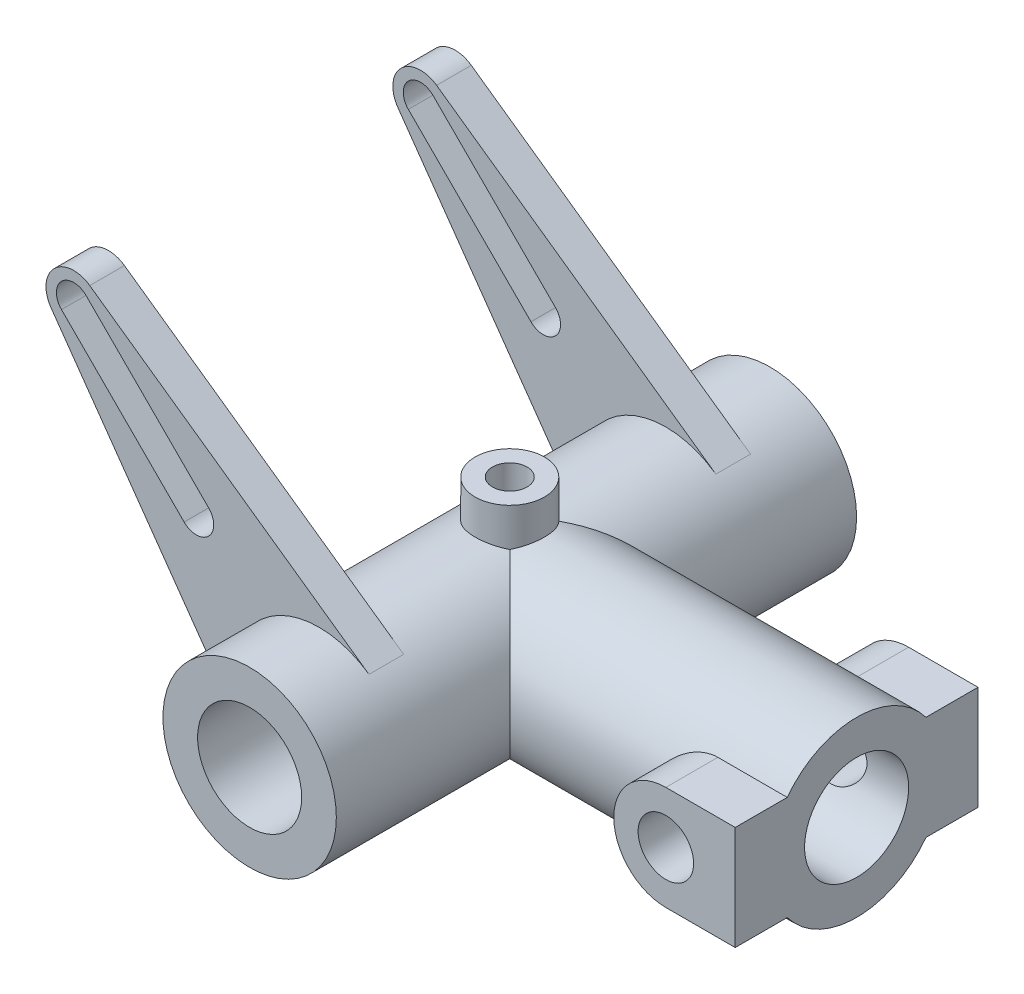
from build123d import *

# Parameters (mm, degrees)
CROQUIS1_R                   = 25
CROQUIS1_R_2                 = 15
SALIENTE_EXTRUIR1_DEPTH      = 75
SALIENTE_EXTRUIR3_REACH      = 184.916
SALIENTE_EXTRUIR3_END_RADIUS = 25
SALIENTE_EXTRUIR3_START      = 100
CROQUIS2_R                   = 25
CROQUIS2_R_2                 = 15
CORTAR_EXTRUIR1_REACH        = 129.475
CROQUIS2_2_R                 = 15
SALIENTE_EXTRUIR4_REACH      = 164.475
SALIENTE_EXTRUIR4_END_RADIUS = 25
SALIENTE_EXTRUIR4_START      = 35
CROQUIS3_W                   = 35
CROQUIS3_H                   = 30
REDONDEO1_R                  = 15
CROQUIS4_R                   = 8
CORTAR_EXTRUIR2_DEPTH        = 151.7481344
SALIENTE_EXTRUIR5_START      = 55
SALIENTE_EXTRUIR5_DEPTH      = 10
SALIENTE_EXTRUIR6_START      = 22.912881
CROQUIS6_R                   = 10
CROQUIS6_R_2                 = 5
SALIENTE_EXTRUIR6_DEPTH      = 12.087119
CORTAR_EXTRUIR3_REACH        = 149.717
CROQUIS6_2_R                 = 5
REDONDEO1_OF_SIMETR_A1_R     = 15


with BuildPart() as part:
    # Croquis1 → Saliente-Extruir1 (new, symmetric)
    with BuildSketch(Plane.XY):
        Circle(CROQUIS1_R)
        Circle(CROQUIS1_R_2, mode=Mode.SUBTRACT)
    extrude(amount=SALIENTE_EXTRUIR1_DEPTH, both=True)

    # Saliente-Extruir3: up to this cylinder (the profile starts outside it)
    saliente_extruir3_end = Plane(origin=(0, 0, 24.292893), z_dir=(0, 0, -1)) * Cylinder(SALIENTE_EXTRUIR3_END_RADIUS, 420.832, mode=Mode.PRIVATE)
    # Croquis2 → Saliente-Extruir3 (add, up to the surface)
    with BuildSketch(Plane(origin=(0, 0, 0), x_dir=(0, 0, -1), z_dir=(1, 0, 0)).offset(SALIENTE_EXTRUIR3_START), mode=Mode.PRIVATE) as saliente_extruir3_sk1:
        Circle(CROQUIS2_R)
        Circle(CROQUIS2_R_2, mode=Mode.SUBTRACT)
    saliente_extruir3_tool1 = extrude(saliente_extruir3_sk1.sketch, amount=-SALIENTE_EXTRUIR3_REACH, mode=Mode.PRIVATE) - saliente_extruir3_end
    add(saliente_extruir3_tool1.solids().sort_by_distance((100, 0, 24.292893))[0])

    # Croquis2<2> → Cortar-Extruir1 (cut, up to next)
    with BuildSketch(Plane(origin=(0, 0, 0), x_dir=(0, 0, -1), z_dir=(1, 0, 0)), mode=Mode.PRIVATE) as cortar_extruir1_sk1:
        Circle(CROQUIS2_2_R)
    cortar_extruir1_tool1 = extrude(cortar_extruir1_sk1.sketch, amount=CORTAR_EXTRUIR1_REACH, mode=Mode.PRIVATE) & part.part
    add(cortar_extruir1_tool1.solids().sort_by_distance((0, 0, 0))[0], mode=Mode.SUBTRACT)

    # Saliente-Extruir4: up to this cylinder (the profile starts outside it)
    saliente_extruir4_end = Plane(origin=(82.5, 0, 0), z_dir=(1, 0, 0)) * Cylinder(SALIENTE_EXTRUIR4_END_RADIUS, 379.95, mode=Mode.PRIVATE)
    # Croquis3 → Saliente-Extruir4 (add, up to the surface)
    with BuildSketch(Plane.XY.offset(SALIENTE_EXTRUIR4_START), mode=Mode.PRIVATE) as saliente_extruir4_sk1:
        with Locations((82.5, 0)):
            Rectangle(CROQUIS3_W, CROQUIS3_H)
    saliente_extruir4_tool1 = extrude(saliente_extruir4_sk1.sketch, amount=-SALIENTE_EXTRUIR4_REACH, mode=Mode.PRIVATE) - saliente_extruir4_end
    saliente_extruir4 = saliente_extruir4_tool1.solids().sort_by_distance((82.5, 0, 35))[0]
    add(saliente_extruir4)

    # Redondeo1
    # the kernel refuses this fillet: 15 mm, written as the material it takes off along each edge
    with BuildSketch(Plane(origin=(65, 15, 72.5), x_dir=(1, 0, 0), z_dir=(0, 0, -1))) as redondeo1_piece_1_section:
        with BuildLine():
            CenterArc((REDONDEO1_R, REDONDEO1_R), REDONDEO1_R, 180, 90)
            Line((0, REDONDEO1_R), (0, 0))
            Line((0, 0), (REDONDEO1_R, 0))
        make_face()
    redondeo1_piece_1 = extrude(amount=90, mode=Mode.PRIVATE)
    redondeo1_piece_1 = redondeo1_piece_1 - Plane(origin=(68.454600716, 0, 0), x_dir=(0, 0, -1), z_dir=(1, 0, 0)) * Cylinder(25, 240, mode=Mode.PRIVATE)
    add(redondeo1_piece_1, mode=Mode.SUBTRACT)
    with BuildSketch(Plane(origin=(65, -15, 72.5), x_dir=(0, 1, 0), z_dir=(0, 0, -1))) as redondeo1_piece_2_section:
        with BuildLine():
            CenterArc((REDONDEO1_R, REDONDEO1_R), REDONDEO1_R, 180, 90)
            Line((0, REDONDEO1_R), (0, 0))
            Line((0, 0), (REDONDEO1_R, 0))
        make_face()
    redondeo1_piece_2 = extrude(amount=90, mode=Mode.PRIVATE)
    redondeo1_piece_2 = redondeo1_piece_2 - Plane(origin=(68.454600972, 0, 0), x_dir=(0, 0, -1), z_dir=(1, 0, 0)) * Cylinder(25, 240, mode=Mode.PRIVATE)
    add(redondeo1_piece_2, mode=Mode.SUBTRACT)

    # Croquis4 → Cortar-Extruir2 (cut, through all)
    with BuildSketch(Plane.XY.offset(35)):
        with Locations((80, 0)):
            Circle(CROQUIS4_R)
    cortar_extruir2 = extrude(amount=-CORTAR_EXTRUIR2_DEPTH, mode=Mode.SUBTRACT)

    # Croquis5 → Saliente-Extruir5 (add)
    with BuildSketch(Plane.XY.offset(SALIENTE_EXTRUIR5_START)):
        with BuildLine():
            ThreePointArc((-20.425558294, -14.415150654), (-17.67766953, 17.67766953), (14.415150654, 20.425558294))
            Line((14.415150654, 20.425558294), (-66.097829909, 77.246856773))
            ThreePointArc((-66.097829909, 77.246856773), (-76.367532368, 76.367532368), (-77.246856773, 66.097829909))
            Line((-77.246856773, 66.097829909), (-20.425558294, -14.415150654))
        make_face()
        with BuildLine():
            ThreePointArc((-74.246212025, 67.175144213), (-74.246212025, 74.246212025), (-67.175144213, 74.246212025))
            Line((-67.175144213, 74.246212025), (-31.819805153, 38.890872965))
            ThreePointArc((-31.819805153, 38.890872965), (-31.819805153, 31.819805153), (-38.890872965, 31.819805153))
            Line((-38.890872965, 31.819805153), (-74.246212025, 67.175144213))
        make_face(mode=Mode.SUBTRACT)
    saliente_extruir5 = extrude(amount=-SALIENTE_EXTRUIR5_DEPTH)

    # Croquis6 → Saliente-Extruir6 (add)
    with BuildSketch(Plane(origin=(0, 0, 0), x_dir=(1, 0, 0), z_dir=(0, 1, 0)).offset(SALIENTE_EXTRUIR6_START)):
        with Locations(Location((0, 0, 0), (0, 0, 270))):
            Circle(CROQUIS6_R)
        with Locations(Location((0, 0, 0), (0, 0, 270))):
            Circle(CROQUIS6_R_2, mode=Mode.SUBTRACT)
    extrude(amount=SALIENTE_EXTRUIR6_DEPTH)

    # Croquis6<2> → Cortar-Extruir3 (cut, up to next)
    with BuildSketch(Plane(origin=(0, 0, 0), x_dir=(1, 0, 0), z_dir=(0, 1, 0)), mode=Mode.PRIVATE) as cortar_extruir3_sk1:
        with Locations(Location((0, 0, 0), (0, 0, 270))):
            Circle(CROQUIS6_2_R)
    cortar_extruir3_tool1 = extrude(cortar_extruir3_sk1.sketch, amount=CORTAR_EXTRUIR3_REACH, mode=Mode.PRIVATE) & part.part
    add(cortar_extruir3_tool1.solids().sort_by_distance((0, 0, 0))[0], mode=Mode.SUBTRACT)

    # Simetría1: Saliente-Extruir4, Cortar-Extruir2, Saliente-Extruir5 across plane
    add(saliente_extruir4.mirror(Plane.XY))
    add(cortar_extruir2.mirror(Plane.XY), mode=Mode.SUBTRACT)
    add(saliente_extruir5.mirror(Plane.XY))

    # Redondeo1 of Simetría1
    # the kernel refuses this fillet: 15 mm, written as the material it takes off along each edge
    with BuildSketch(Plane(origin=(65, 15, -72.5), x_dir=(0, -1, 0), z_dir=(0, 0, 1))) as redondeo1_of_simetr_a1_piece_1_section:
        with BuildLine():
            CenterArc((REDONDEO1_OF_SIMETR_A1_R, REDONDEO1_OF_SIMETR_A1_R), REDONDEO1_OF_SIMETR_A1_R, 180, 90)
            Line((0, REDONDEO1_OF_SIMETR_A1_R), (0, 0))
            Line((0, 0), (REDONDEO1_OF_SIMETR_A1_R, 0))
        make_face()
    redondeo1_of_simetr_a1_piece_1 = extrude(amount=90, mode=Mode.PRIVATE)
    redondeo1_of_simetr_a1_piece_1 = redondeo1_of_simetr_a1_piece_1 - Plane(origin=(68.454600972, 0, 0), x_dir=(0, 0, -1), z_dir=(1, 0, 0)) * Cylinder(25, 240, mode=Mode.PRIVATE)
    add(redondeo1_of_simetr_a1_piece_1, mode=Mode.SUBTRACT)
    with BuildSketch(Plane(origin=(65, -15, -72.5), x_dir=(0, 1, 0), z_dir=(0, 0, 1))) as redondeo1_of_simetr_a1_piece_2_section:
        with BuildLine():
            CenterArc((REDONDEO1_OF_SIMETR_A1_R, -REDONDEO1_OF_SIMETR_A1_R), REDONDEO1_OF_SIMETR_A1_R, 90, 90)
            Line((0, -REDONDEO1_OF_SIMETR_A1_R), (0, 0))
            Line((0, 0), (REDONDEO1_OF_SIMETR_A1_R, 0))
        make_face()
    redondeo1_of_simetr_a1_piece_2 = extrude(amount=90, mode=Mode.PRIVATE)
    redondeo1_of_simetr_a1_piece_2 = redondeo1_of_simetr_a1_piece_2 - Plane(origin=(68.454600579, 0, 0), x_dir=(0, 0, -1), z_dir=(1, 0, 0)) * Cylinder(25, 240, mode=Mode.PRIVATE)
    add(redondeo1_of_simetr_a1_piece_2, mode=Mode.SUBTRACT)


solid = part.part
